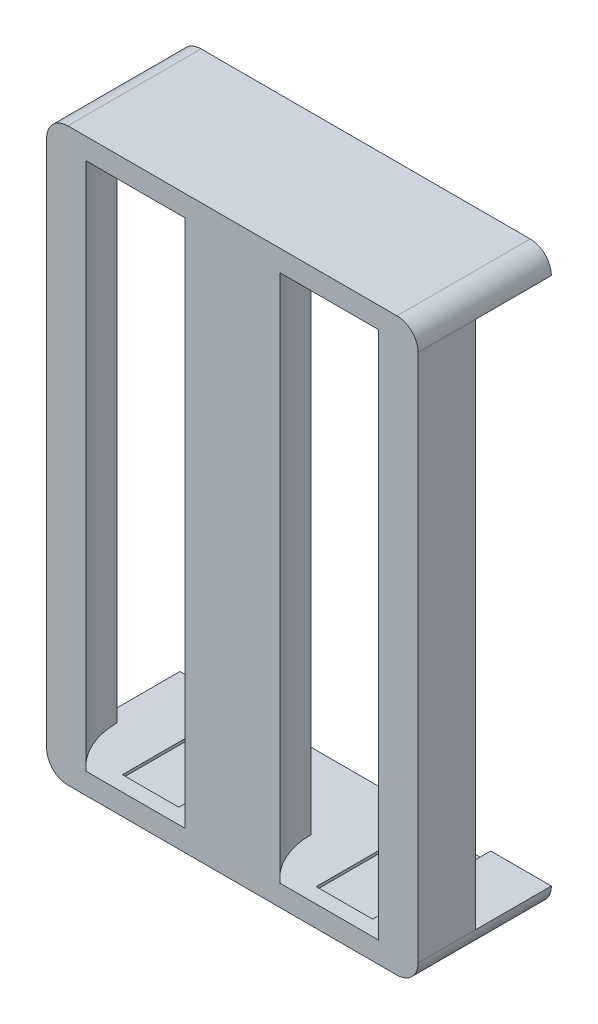
from build123d import *

# Parameters (mm, degrees)
BOSS_EXTRUDE1_DEPTH  = 75
SKETCH1_3_W          = 52.7
SKETCH1_3_H          = 18.9
BOSS_EXTRUDE2_DEPTH  = 3
CUT_EXTRUDE1_DEPTH   = 16.75
MIRROR3_COPY_1_DEPTH = 16.75
SKETCH5_W            = 15.25
SKETCH5_H            = 1.1
CUT_EXTRUDE2_DEPTH   = 2
FILLET1_R            = 3


with BuildPart() as part:
    # Sketch1 → Boss-Extrude1 (new body)
    with BuildSketch(Plane(origin=(0, 0, 0), x_dir=(1, 0, 0), z_dir=(0, 1, 0))):
        with BuildLine():
            Line((47.109992867, 3), (52.7, 3))
            Line((52.7, 3), (52.7, 11.15))
            Line((52.7, 11.15), (50.85, 11.15))
            ThreePointArc((50.85, 11.15), (49.870361389, 6.666414567), (47.109992867, 3))
        make_face()
        with BuildLine():
            Line((26.35, 11.15), (26.35, 3))
            Line((26.35, 3), (33.090007133, 3))
            ThreePointArc((33.090007133, 3), (30.329638611, 6.666414567), (29.35, 11.15))
            Line((29.35, 11.15), (26.35, 11.15))
        make_face()
        with BuildLine():
            Line((19.609992867, 3), (26.35, 3))
            Line((26.35, 3), (26.35, 11.15))
            Line((26.35, 11.15), (23.35, 11.15))
            ThreePointArc((23.35, 11.15), (22.370361389, 6.666414567), (19.609992867, 3))
        make_face()
        with BuildLine():
            Line((0, 3), (5.590007133, 3))
            ThreePointArc((5.590007133, 3), (2.829638611, 6.666414567), (1.85, 11.15))
            Line((1.85, 11.15), (0, 11.15))
            Line((0, 11.15), (0, 3))
        make_face()
    extrude(amount=BOSS_EXTRUDE1_DEPTH)

    # Sketch1<3> → Boss-Extrude2 (add)
    with BuildSketch(Plane(origin=(0, 0, 0), x_dir=(1, 0, 0), z_dir=(0, 1, 0))):
        with Locations((26.35, 12.45)):
            Rectangle(SKETCH1_3_W, SKETCH1_3_H)
    boss_extrude2 = extrude(amount=-BOSS_EXTRUDE2_DEPTH)

    # Sketch4 → Cut-Extrude1 (cut)
    with BuildSketch(Plane(origin=(0, 0, -21.9), x_dir=(-1, 0, 0), z_dir=(0, 0, -1))):
        Polygon((-18.725, -1.5), (-6.475, -1.5), (-6.475, -0.4), (-8.6, -0.4), (-8.6, 0), (-16.6, 0), (-16.6, -0.4), (-18.725, -0.4), align=None)
    cut_extrude1 = extrude(amount=-CUT_EXTRUDE1_DEPTH, mode=Mode.SUBTRACT)

    # Mirror2: Cut-Extrude1 across plane
    add(cut_extrude1.mirror(Plane(origin=(26.35, 0, 0), x_dir=(0, 0, 1), z_dir=(1, 0, 0))), mode=Mode.SUBTRACT)

    # Mirror3: Boss-Extrude2, Cut-Extrude1 across plane
    add(boss_extrude2.mirror(Plane.ZX.offset(37.5)))
    add(cut_extrude1.mirror(Plane.ZX.offset(37.5)), mode=Mode.SUBTRACT)

    # Mirror3 copy 1 sketch → Mirror3 copy 1 (cut)
    with BuildSketch(Plane(origin=(52.7, 75, -21.9), x_dir=(1, 0, 0), z_dir=(0, 0, -1))):
        Polygon((-18.725, -1.5), (-6.475, -1.5), (-6.475, -0.4), (-8.6, -0.4), (-8.6, 0), (-16.6, 0), (-16.6, -0.4), (-18.725, -0.4), align=None)
    extrude(amount=-MIRROR3_COPY_1_DEPTH, mode=Mode.SUBTRACT)

    # Sketch5 → Cut-Extrude2 (cut)
    with BuildSketch(Plane(origin=(0, 0, -21.9), x_dir=(-1, 0, 0), z_dir=(0, 0, -1))):
        with Locations((-26.35, 75.95)):
            Rectangle(SKETCH5_W, SKETCH5_H)
    extrude(amount=-CUT_EXTRUDE2_DEPTH, mode=Mode.SUBTRACT)

    # Fillet1
    fillet1_edges = [part.edges().sort_by_distance(p)[0] for p in [
        (0, 78, -12.45),
        (52.7, 78, -12.45),
        (52.7, -3, -12.45),
        (0, -3, -12.45),
    ]]
    fillet(fillet1_edges, radius=FILLET1_R - 0.0001)  # a hair under: the kernel refuses the full size


solid = part.part
